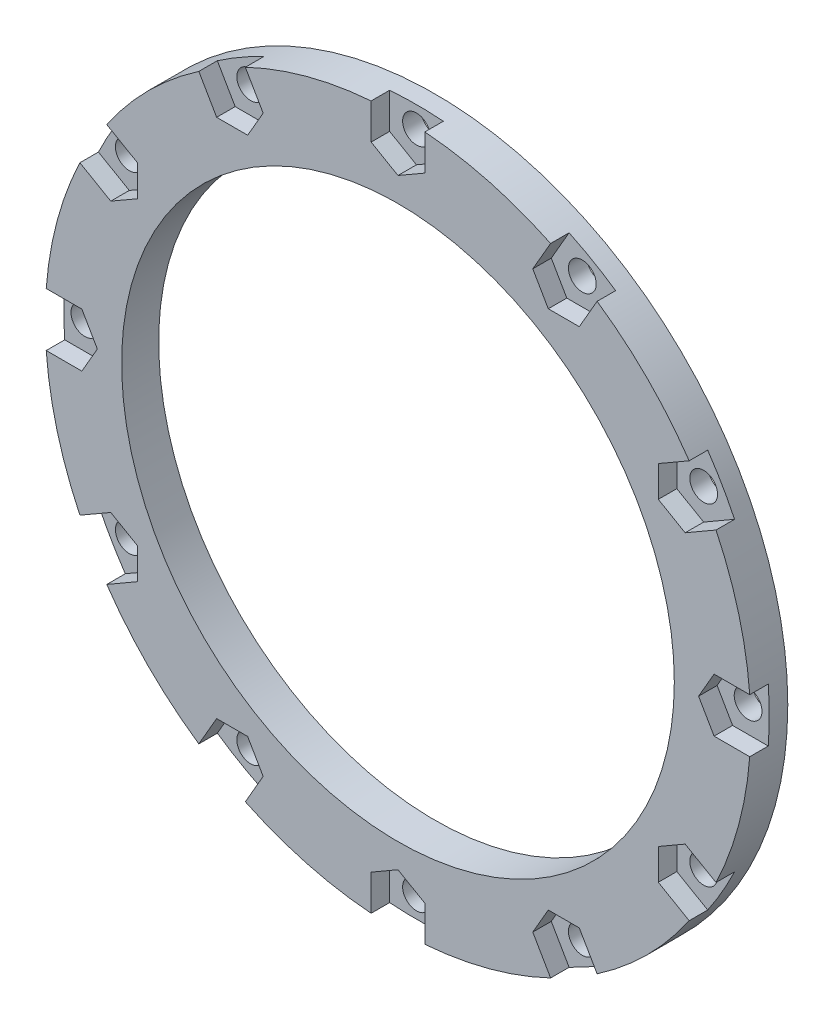
from build123d import *

# Parameters (mm, degrees)
SKETCH1_R           = 38.1
SKETCH1_R_2         = 29.845
BOSS_EXTRUDE1_DEPTH = 4
SKETCH2_R           = 1.5
CUT_EXTRUDE1_DEPTH  = 55.029806589
CUT_EXTRUDE2_DEPTH  = 2


with BuildPart() as part:
    # Sketch1 → Boss-Extrude1 (new body)
    with BuildSketch(Plane.XY):
        Circle(SKETCH1_R)
        Circle(SKETCH1_R_2, mode=Mode.SUBTRACT)
    extrude(amount=BOSS_EXTRUDE1_DEPTH)

    # Sketch2 → Cut-Extrude1 (cut, through all)
    with BuildSketch(Plane.XY.offset(4)):
        with Locations((0, 35.814)):
            Circle(SKETCH2_R)
        with Locations((17.907, 31.015833811)):
            Circle(SKETCH2_R)
        with Locations((31.015833811, 17.907)):
            Circle(SKETCH2_R)
        with Locations((35.814, 0)):
            Circle(SKETCH2_R)
        with Locations((31.015833811, -17.907)):
            Circle(SKETCH2_R)
        with Locations((17.907, -31.015833811)):
            Circle(SKETCH2_R)
        with Locations((0, -35.814)):
            Circle(SKETCH2_R)
        with Locations((-17.907, -31.015833811)):
            Circle(SKETCH2_R)
        with Locations((-31.015833811, -17.907)):
            Circle(SKETCH2_R)
        with Locations((-35.814, 0)):
            Circle(SKETCH2_R)
        with Locations((-31.015833811, 17.907)):
            Circle(SKETCH2_R)
        with Locations((-17.907, 31.015833811)):
            Circle(SKETCH2_R)
    extrude(amount=-CUT_EXTRUDE1_DEPTH, mode=Mode.SUBTRACT)

    # Sketch3 → Cut-Extrude2 (cut)
    with BuildSketch(Plane.XY.offset(4)):
        Polygon((-2.9, 37.989472226), (0, 39.162631561), (2.9, 37.989472226), (2.9, 34.139684219), (0, 32.465368439), (-2.9, 34.139684219), align=None)
        Polygon((16.483262442, 34.349848024), (19.581315781, 33.915833811), (21.506209784, 31.449848024), (19.581315781, 28.115833811), (16.232684219, 28.115833811), (14.558368439, 31.015833811), align=None)
        Polygon((31.449848024, 21.506209784), (33.915833811, 19.581315781), (34.349848024, 16.483262442), (31.015833811, 14.558368439), (28.115833811, 16.232684219), (28.115833811, 19.581315781), align=None)
        Polygon((37.989472226, 2.9), (39.162631561, 0), (37.989472226, -2.9), (34.139684219, -2.9), (32.465368439, 0), (34.139684219, 2.9), align=None)
        Polygon((34.349848024, -16.483262442), (33.915833811, -19.581315781), (31.449848024, -21.506209784), (28.115833811, -19.581315781), (28.115833811, -16.232684219), (31.015833811, -14.558368439), align=None)
        Polygon((21.506209784, -31.449848024), (19.581315781, -33.915833811), (16.483262442, -34.349848024), (14.558368439, -31.015833811), (16.232684219, -28.115833811), (19.581315781, -28.115833811), align=None)
        Polygon((2.9, -37.989472226), (0, -39.162631561), (-2.9, -37.989472226), (-2.9, -34.139684219), (0, -32.465368439), (2.9, -34.139684219), align=None)
        Polygon((-16.483262442, -34.349848024), (-19.581315781, -33.915833811), (-21.506209784, -31.449848024), (-19.581315781, -28.115833811), (-16.232684219, -28.115833811), (-14.558368439, -31.015833811), align=None)
        Polygon((-31.449848024, -21.506209784), (-33.915833811, -19.581315781), (-34.349848024, -16.483262442), (-31.015833811, -14.558368439), (-28.115833811, -16.232684219), (-28.115833811, -19.581315781), align=None)
        Polygon((-37.989472226, -2.9), (-39.162631561, 0), (-37.989472226, 2.9), (-34.139684219, 2.9), (-32.465368439, 0), (-34.139684219, -2.9), align=None)
        Polygon((-34.349848024, 16.483262442), (-33.915833811, 19.581315781), (-31.449848024, 21.506209784), (-28.115833811, 19.581315781), (-28.115833811, 16.232684219), (-31.015833811, 14.558368439), align=None)
        Polygon((-21.506209784, 31.449848024), (-19.581315781, 33.915833811), (-16.483262442, 34.349848024), (-14.558368439, 31.015833811), (-16.232684219, 28.115833811), (-19.581315781, 28.115833811), align=None)
    extrude(amount=-CUT_EXTRUDE2_DEPTH, mode=Mode.SUBTRACT)


solid = part.part
